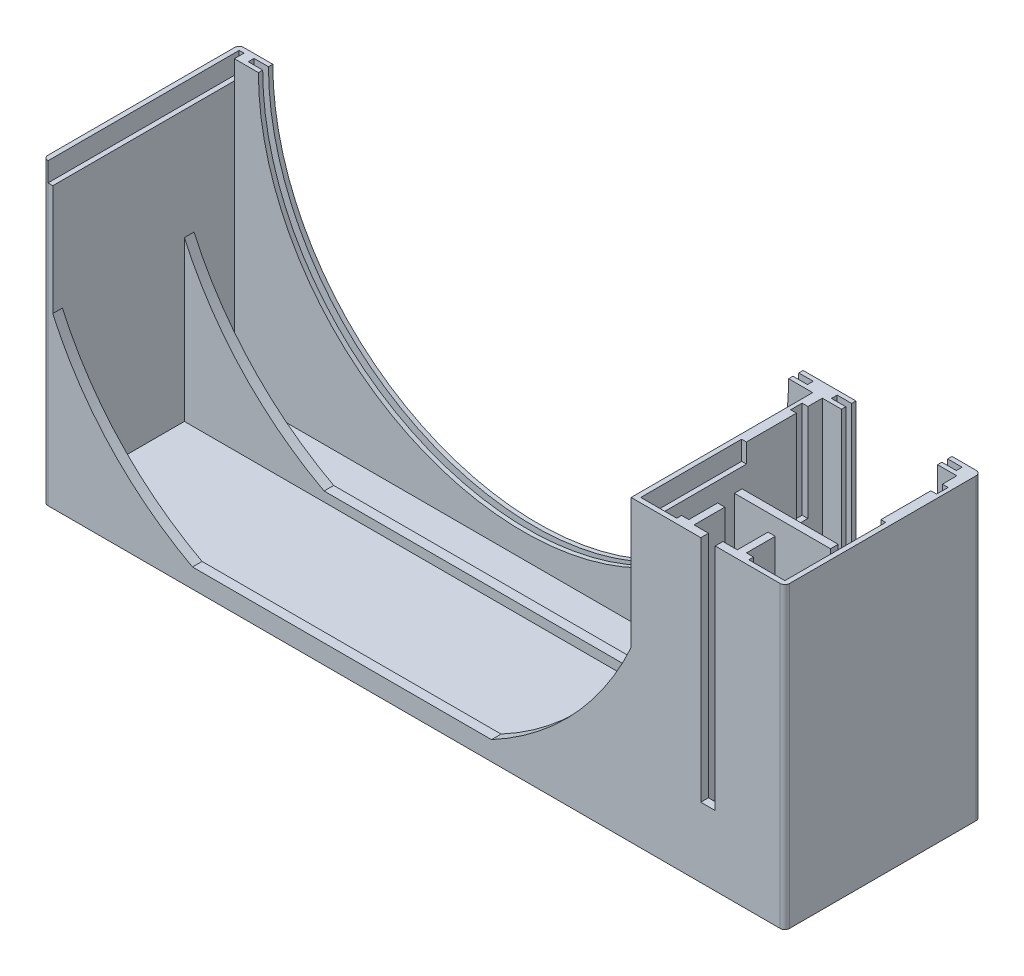
from build123d import *

# Parameters (mm, degrees)
ESQUISSE1_W              = 154.4
ESQUISSE1_H              = 40.8
BOSS_EXTRU_1_DEPTH       = 2
ESQUISSE2_W              = 154.4
ESQUISSE2_H              = 40.8
ESQUISSE2_W_2            = 120.4
ESQUISSE2_H_2            = 8.4
ESQUISSE2_H_3            = 25.4
BOSS_EXTRU_2_DEPTH       = 60.2
ENL_V_MAT_EXTRU_1_REACH  = 173.385
ESQUISSE4_W              = 1
ESQUISSE4_H              = 39.8
ENL_V_MAT_EXTRU_2_DEPTH  = 4
ESQUISSE5_W              = 1.2
ESQUISSE5_H              = 2.4
ENL_V_MAT_EXTRU_3_DEPTH  = 20.2
BOSS_EXTRU_3_DEPTH       = 8
ESQUISSE9_W              = 9
ESQUISSE9_H              = 51.7
ENL_V_MAT_EXTRU_5_DEPTH  = 6.4
ESQUISSE10_W             = 3
ESQUISSE10_H             = 47.7
ENL_V_MAT_EXTRU_6_DEPTH  = 172.011227702
ESQUISSE11_W             = 20
ESQUISSE11_H             = 1.6
BOSS_EXTRU_4_DEPTH       = 60.2
ENL_V_MAT_EXTRU_7_REACH  = 173.385
ESQUISSE12_R             = 55.2
ENL_V_START              = -0.9
ESQUISSE14_R             = 58.2
ENL_V_MAT_EXTRU_8_DEPTH  = 1.2
CONG_1_R                 = 1
ENL_V_MAT_EXTRU_9_REACH  = 173.385
ESQUISSE15_W             = 20
ESQUISSE15_H             = 47.2
ESQUISSE16_W             = 26
ESQUISSE16_H             = 53.2
ESQUISSE16_W_2           = 20
ESQUISSE16_H_2           = 47.2
ENL_V_MAT_EXTRU_11_DEPTH = 1.2


with BuildPart() as part:
    # Esquisse1 → Boss.-Extru.1 (new body)
    with BuildSketch(Plane(origin=(0, 0, 0), x_dir=(1, 0, 0), z_dir=(0, 1, 0))):
        with Locations((77.2, 20.4)):
            Rectangle(ESQUISSE1_W, ESQUISSE1_H)
    extrude(amount=BOSS_EXTRU_1_DEPTH)

    # Esquisse2 → Boss.-Extru.2 (add)
    with BuildSketch(Plane(origin=(0, 2, 0), x_dir=(1, 0, 0), z_dir=(0, 1, 0))):
        with Locations((77.2, 20.4)):
            Rectangle(ESQUISSE2_W, ESQUISSE2_H)
        with Locations((62.2, 33.6)):
            Rectangle(ESQUISSE2_W_2, ESQUISSE2_H_2, mode=Mode.SUBTRACT)
        with Locations((62.2, 14.7)):
            Rectangle(ESQUISSE2_W_2, ESQUISSE2_H_3, mode=Mode.SUBTRACT)
        Polygon((124.4, 37.8), (124.4, 2), (132.4, 2), (132.4, 8), (144.4, 8), (144.4, 2), (152.4, 2), (152.4, 37.8), align=None, mode=Mode.SUBTRACT)
    extrude(amount=BOSS_EXTRU_2_DEPTH)

    # Enlèv. mat.-Extru.1: up to this face of the body (flat: up to its plane)
    enl_v_mat_extru_1_end = Plane(part.part.faces().sort_by_distance((62.2, 32.1, -29.4))[0])
    # Esquisse3 → Enlèv. mat.-Extru.1 (cut, up to the picked face)
    with BuildSketch(Plane.XY, mode=Mode.PRIVATE) as enl_v_mat_extru_1_sk1:
        with BuildLine():
            Line((2, 62.2), (122.4, 62.2))
            Line((122.4, 62.2), (122.4, 35.145240714))
            ThreePointArc((122.4, 35.145240714), (110.444857601, 17.16186377), (93.324909638, 4))
            Line((93.324909638, 4), (31.075090362, 4))
            ThreePointArc((31.075090362, 4), (13.955142399, 17.16186377), (2, 35.145240714))
            Line((2, 35.145240714), (2, 62.2))
        make_face()
    enl_v_mat_extru_1_tool1 = split(extrude(enl_v_mat_extru_1_sk1.sketch, amount=-ENL_V_MAT_EXTRU_1_REACH, mode=Mode.PRIVATE), bisect_by=enl_v_mat_extru_1_end, keep=Keep.BOTH, mode=Mode.PRIVATE)
    add(enl_v_mat_extru_1_tool1.solids().sort_by(Axis((62.2, 35.325026, 0), (0, 0, -1)))[0], mode=Mode.SUBTRACT)

    # Esquisse4 → Enlèv. mat.-Extru.2 (cut)
    with BuildSketch(Plane(origin=(0, 62.2, 0), x_dir=(1, 0, 0), z_dir=(0, 1, 0))):
        with Locations((1.5, 19.9)):
            Rectangle(ESQUISSE4_W, ESQUISSE4_H)
        Polygon((130.9, 1), (130.9, 2), (124.4, 2), (124.4, 22), (123.4, 22), (123.4, 2), (123.4, 1), align=None)
        Polygon((152.4, 2), (152.4, 22), (153.4, 22), (153.4, 2), (153.4, 1), (145.9, 1), (145.9, 2), align=None)
    extrude(amount=-ENL_V_MAT_EXTRU_2_DEPTH, mode=Mode.SUBTRACT)

    # Esquisse5 → Enlèv. mat.-Extru.3 (cut)
    with BuildSketch(Plane(origin=(0, 62.2, 0), x_dir=(1, 0, 0), z_dir=(0, 1, 0))):
        with Locations((123.8, 33.6)):
            Rectangle(ESQUISSE5_W, ESQUISSE5_H)
        with Locations((153, 33.6)):
            Rectangle(ESQUISSE5_W, ESQUISSE5_H)
    extrude(amount=-ENL_V_MAT_EXTRU_3_DEPTH, mode=Mode.SUBTRACT)

    # Esquisse6 → Boss.-Extru.3 (add)
    with BuildSketch(Plane(origin=(0, 2, 0), x_dir=(1, 0, 0), z_dir=(0, 1, 0))):
        Polygon((133, 22.4), (133, 37.8), (131.8, 37.8), (131.8, 21.2), (152.4, 21.2), (152.4, 22.4), align=None)
    extrude(amount=BOSS_EXTRU_3_DEPTH)

    # Esquisse9 → Enlèv. mat.-Extru.5 (cut)
    with BuildSketch(Plane(origin=(0, 0, -8), x_dir=(-1, 0, 0), z_dir=(0, 0, -1))):
        with Locations((-138.4, 36.35)):
            Rectangle(ESQUISSE9_W, ESQUISSE9_H)
    extrude(amount=-ENL_V_MAT_EXTRU_5_DEPTH, mode=Mode.SUBTRACT)

    # Esquisse10 → Enlèv. mat.-Extru.6 (cut, through all)
    with BuildSketch(Plane(origin=(0, 0, -1.6), x_dir=(-1, 0, 0), z_dir=(0, 0, -1))):
        with Locations((-138.4, 38.35)):
            Rectangle(ESQUISSE10_W, ESQUISSE10_H)
    extrude(amount=-ENL_V_MAT_EXTRU_6_DEPTH, mode=Mode.SUBTRACT)

    # Esquisse11 → Boss.-Extru.4 (add)
    with BuildSketch(Plane(origin=(0, 2, 0), x_dir=(1, 0, 0), z_dir=(0, 1, 0))):
        with Locations((142.4, 12.3)):
            Rectangle(ESQUISSE11_W, ESQUISSE11_H)
    extrude(amount=BOSS_EXTRU_4_DEPTH)

    # Esquisse12 → Enlèv. mat.-Extru.7 (cut, up to next)
    with BuildSketch(Plane(origin=(0, 0, -40.8), x_dir=(-1, 0, 0), z_dir=(0, 0, -1)), mode=Mode.PRIVATE) as enl_v_mat_extru_7_sk1:
        with Locations((-62.2, 62.2)):
            Circle(ESQUISSE12_R)
    enl_v_mat_extru_7_tool1 = extrude(enl_v_mat_extru_7_sk1.sketch, amount=-ENL_V_MAT_EXTRU_7_REACH, mode=Mode.PRIVATE) & part.part
    add(enl_v_mat_extru_7_tool1.solids().sort_by_distance((62.2, 62.2, -40.8))[0], mode=Mode.SUBTRACT)

    # Esquisse14 → Enlèv. mat.-Extru.8 (cut)
    with BuildSketch(Plane(origin=(0, 0, -40.8), x_dir=(-1, 0, 0), z_dir=(0, 0, -1)).offset(ENL_V_START)):
        with Locations((-62.2, 62.2)):
            Circle(ESQUISSE14_R)
    extrude(amount=-ENL_V_MAT_EXTRU_8_DEPTH, mode=Mode.SUBTRACT)

    # Congé1
    cong_1_edges = [part.edges().sort_by_distance(p)[0] for p in [
        (0, 31.1, -40.8),
        (154.4, 31.1, -40.8),
        (154.4, 31.1, 0),
        (0, 31.1, 0),
    ]]
    fillet(cong_1_edges, radius=CONG_1_R - 0.0001)  # a hair under: the kernel refuses the full size

    # Esquisse15 → Enlèv. mat.-Extru.9 (cut, up to next)
    with BuildSketch(Plane(origin=(0, 0, -40.8), x_dir=(-1, 0, 0), z_dir=(0, 0, -1)), mode=Mode.PRIVATE) as enl_v_mat_extru_9_sk1:
        with Locations((-138.4, 38.6)):
            Rectangle(ESQUISSE15_W, ESQUISSE15_H)
    enl_v_mat_extru_9_tool1 = extrude(enl_v_mat_extru_9_sk1.sketch, amount=-ENL_V_MAT_EXTRU_9_REACH, mode=Mode.PRIVATE) & part.part
    add(enl_v_mat_extru_9_tool1.solids().sort_by_distance((138.4, 38.6, -40.8))[0], mode=Mode.SUBTRACT)

    # Esquisse16 → Enlèv. mat.-Extru.11 (cut)
    with BuildSketch(Plane(origin=(0, 0, -40.8), x_dir=(-1, 0, 0), z_dir=(0, 0, -1)).offset(ENL_V_START)):
        with Locations((-138.4, 38.6)):
            Rectangle(ESQUISSE16_W, ESQUISSE16_H)
        with Locations((-138.4, 38.6)):
            Rectangle(ESQUISSE16_W_2, ESQUISSE16_H_2, mode=Mode.SUBTRACT)
    extrude(amount=-ENL_V_MAT_EXTRU_11_DEPTH, mode=Mode.SUBTRACT)


solid = part.part
